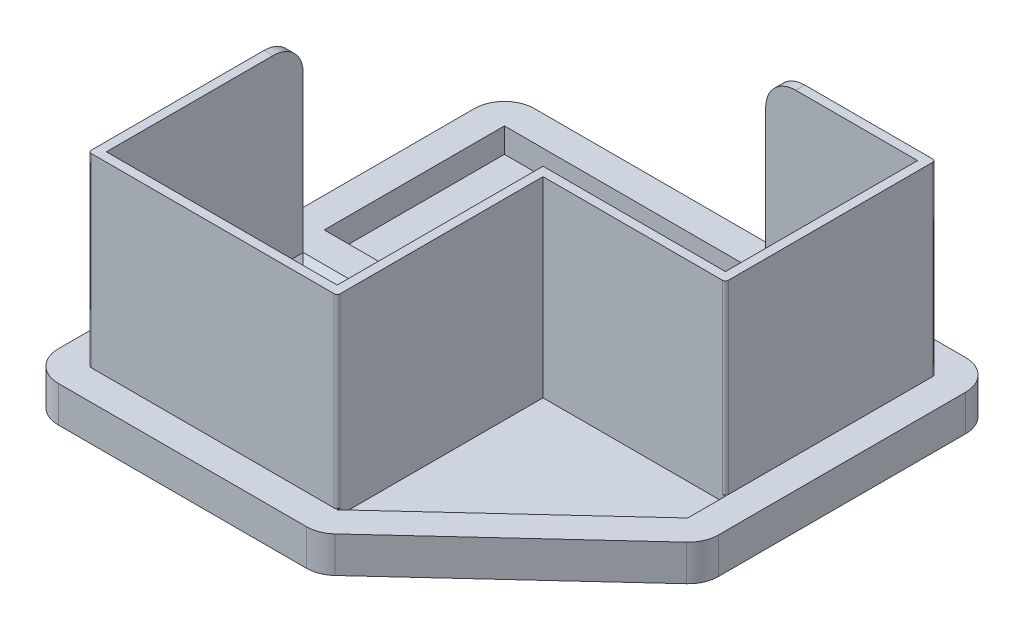
from build123d import *

# Parameters (mm, degrees)
BOSS_EXTRUDE1_DEPTH = 60
SKETCH3_W           = 400
SKETCH3_H           = 300
CUT_EXTRUDE1_DEPTH  = 41
BOSS_EXTRUDE2_DEPTH = 350
BOSS_EXTRUDE3_DEPTH = 350
FILLET1_R           = 50
FILLET2_R           = 50
SKETCH6_W           = 253
SKETCH6_H           = 320
SKETCH6_W_2         = 384.289648178
SKETCH6_H_2         = 327.7
BOSS_EXTRUDE4_DEPTH = 31
CHAMFER5_SIZE       = 10
FILLET3_R           = 5


with BuildPart() as part:
    # Sketch1 → Boss-Extrude1 (new body)
    with BuildSketch(Plane(origin=(0, 0, 0), x_dir=(1, 0, 0), z_dir=(0, 1, 0))):
        Polygon((818, 792.7), (0, 792.7), (0, 0), (482.77197137, 0), (818, 309.005759394), align=None)
    extrude(amount=BOSS_EXTRUDE1_DEPTH)

    # Sketch3 → Cut-Extrude1 (cut)
    with BuildSketch(Plane(origin=(0, 60, 0), x_dir=(1, 0, 0), z_dir=(0, 1, 0))):
        with Locations((250, 592.7)):
            Rectangle(SKETCH3_W, SKETCH3_H)
        Polygon((168.605055776, 392.7), (500, 392.7), (500, 678.249343647), (500, 742.7), (768, 742.7), (768, 329.953464166), (464.289648178, 50), (50, 50), (50, 392.7), align=None)
    extrude(amount=-CUT_EXTRUDE1_DEPTH, mode=Mode.SUBTRACT)

    # Sketch4 → Boss-Extrude2 (add)
    with BuildSketch(Plane(origin=(0, 19, 0), x_dir=(1, 0, 0), z_dir=(0, 1, 0))):
        Polygon((464.289648178, 50), (464.289648178, 392.7), (449.289648178, 392.7), (449.289648178, 65), (65, 65), (65, 392.7), (50, 392.7), (50, 50), align=None)
    extrude(amount=BOSS_EXTRUDE2_DEPTH)

    # Sketch5 → Boss-Extrude3 (add)
    with BuildSketch(Plane(origin=(0, 19, 0), x_dir=(1, 0, 0), z_dir=(0, 1, 0))):
        Polygon((768, 392.7), (768, 742.7), (500, 742.7), (500, 727.7), (753, 727.7), (753, 407.7), (500, 407.7), (449.289648178, 407.7), (449.289648178, 392.7), align=None)
    extrude(amount=BOSS_EXTRUDE3_DEPTH)

    # Fillet1
    fillet1_edges = [part.edges().sort_by_distance(p)[0] for p in [
        (57.5, 369, -392.7),
        (500, 369, -735.2),
    ]]
    fillet(fillet1_edges, radius=FILLET1_R)

    # Fillet2
    fillet2_edges = [part.edges().sort_by_distance(p)[0] for p in [
        (0, 30, 0),
        (0, 30, -792.7),
        (818, 30, -792.7),
        (818, 30, -309.005759394),
        (482.77197137, 30, 0),
    ]]
    fillet(fillet2_edges, radius=FILLET2_R)

    # Sketch6 → Boss-Extrude4 (add)
    with BuildSketch(Plane(origin=(0, 19, 0), x_dir=(1, 0, 0), z_dir=(0, 1, 0))):
        Polygon((768, 392.7), (464.289648178, 392.7), (464.289648178, 50), (768, 329.953464166), align=None)
        with Locations((626.5, 567.7)):
            Rectangle(SKETCH6_W, SKETCH6_H)
        with Locations((257.144824089, 228.85)):
            Rectangle(SKETCH6_W_2, SKETCH6_H_2)
    extrude(amount=BOSS_EXTRUDE4_DEPTH)

    # Chamfer5
    chamfer5_edges = [part.edges().sort_by_distance(p)[0] for p in [
        (753, 50, -567.7),
        (626.5, 50, -727.7),
        (500, 50, -567.7),
        (626.5, 50, -407.7),
        (449.289648178, 50, -228.85),
        (257.144824089, 50, -392.7),
        (65, 50, -228.85),
        (257.144824089, 50, -65),
    ]]
    chamfer(chamfer5_edges, length=CHAMFER5_SIZE - 0.0001)  # a hair under: the kernel refuses the full size

    # Fillet3
    fillet3_edges = [part.edges().sort_by_distance(p)[0] for p in [
        (50, 214.5, -50),
        (464.289648178, 214.5, -50),
        (768, 214.5, -392.7),
        (768, 214.5, -742.7),
    ]]
    fillet(fillet3_edges, radius=FILLET3_R)


solid = part.part
